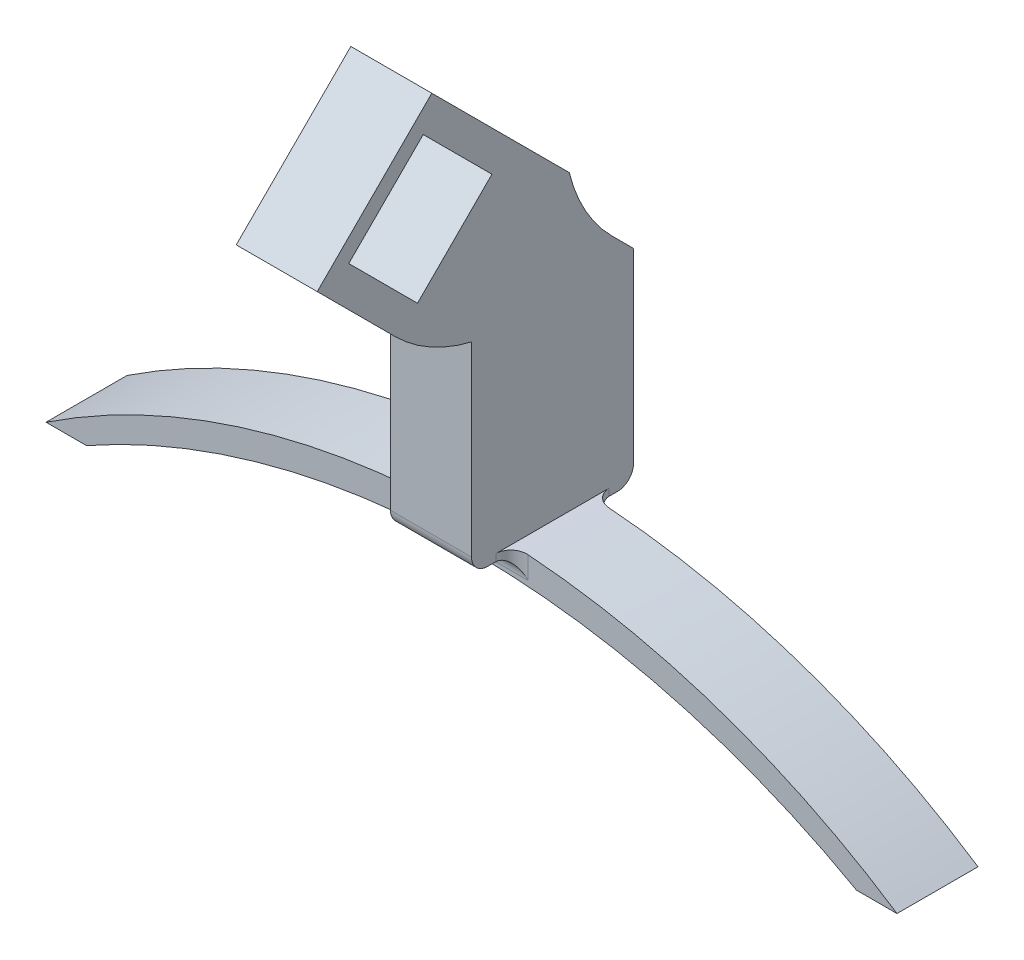
from build123d import *

# Parameters (mm, degrees)
BOSS_EXTRUDE1_DEPTH = 10
SCALE1_SCALE        = 0.5
SKETCH4_W           = 2.5
SKETCH4_H           = 5
BOSS_EXTRUDE4_DEPTH = 12
SKETCH5_W           = 5
SKETCH5_H           = 10
BOSS_EXTRUDE5_DEPTH = 0.5
BOSS_EXTRUDE6_REACH = 83.657
SKETCH7_W           = 5
SKETCH7_H           = 7.071067812
SKETCH8_W           = 5
SKETCH8_H           = 1.464466094
SKETCH8_H_2         = 7.071067812
BOSS_EXTRUDE7_DEPTH = 12
FILLET1_START       = 49
FILLET1_DEPTH       = 7
FILLET1_START_2     = 50.028561354
FILLET1_2_DEPTH     = 5
CUT_EXTRUDE1_DEPTH  = 53.473637274
FILLET2_R           = 1


with BuildPart() as part:
    # Sketch1 → Boss-Extrude1 (new body)
    with BuildSketch(Plane.XY):
        with BuildLine():
            Line((0, 0), (5, 0))
            ThreePointArc((5, 0), (52.528561354, 12.453541306), (100.057122708, 0))
            Line((100.057122708, 0), (105.057122708, 0))
            ThreePointArc((105.057122708, 0), (52.528561354, 15.847728612), (0, 0))
        make_face()
    extrude(amount=BOSS_EXTRUDE1_DEPTH)


with BuildPart() as part_1:
    # Scale1: scaled about (52.528561354, 9.724546383, 5)
    add(part.part.scale(SCALE1_SCALE).moved(Location((26.264280677, 4.862273191, 2.5))))



with BuildPart() as body_2:
    # Sketch4 → Boss-Extrude4 (new body)
    with BuildSketch(Plane(origin=(0, 12.786137497, 0), x_dir=(1, 0, 0), z_dir=(0, 1, 0))):
        with Locations((53.778561354, -5)):
            Rectangle(SKETCH4_W, SKETCH4_H)
        Polygon((50.028561354, 0), (50.028561354, -2.5), (52.528561354, -2.5), (55.028561354, -2.5), (55.028561354, 0), align=None)
        with Locations((51.278561354, -5)):
            Rectangle(SKETCH4_W, SKETCH4_H)
        Polygon((52.528561354, -7.5), (50.028561354, -7.5), (50.028561354, -10), (55.028561354, -10), (55.028561354, -7.5), align=None)
    extrude(amount=BOSS_EXTRUDE4_DEPTH)


with BuildPart() as part_2:
    add(part_1.part)

    add(body_2.part)  # Boss-Extrude5 merges body 2
    # Sketch5 → Boss-Extrude5 (add)
    with BuildSketch(Plane.XZ.offset(-12.786137497)):
        with Locations((52.528561354, 5)):
            Rectangle(SKETCH5_W, SKETCH5_H)
    extrude(amount=BOSS_EXTRUDE5_DEPTH)

    # Boss-Extrude6: up to this plane
    boss_extrude6_end = Plane(origin=(50.028561354, 12.286137497, 0), z_dir=(0, 0, 1))
    # Sketch7 → Boss-Extrude6 (add, up to the surface)
    with BuildSketch(Plane(origin=(0, 17.393068749, 17.393068749), x_dir=(1, 0, 0), z_dir=(0, 0.7071067811865464, 0.7071067811865488)), mode=Mode.PRIVATE) as boss_extrude6_sk1:
        with Locations((52.528561354, 13.990911998)):
            Rectangle(SKETCH7_W, SKETCH7_H)
    boss_extrude6_tool1 = split(extrude(boss_extrude6_sk1.sketch, amount=-BOSS_EXTRUDE6_REACH, mode=Mode.PRIVATE), bisect_by=boss_extrude6_end, keep=Keep.BOTH, mode=Mode.PRIVATE)
    add(boss_extrude6_tool1.solids().sort_by_distance((52.528561, 27.286137, 7.5))[0])

    # Sketch8 → Boss-Extrude7 (add)
    with BuildSketch(Plane(origin=(0, 17.393068749, 17.393068749), x_dir=(1, 0, 0), z_dir=(0, 0.7071067811865465, 0.7071067811865487))):
        with Locations((52.528561354, 18.258678951)):
            Rectangle(SKETCH8_W, SKETCH8_H)
        with Locations((52.528561354, 13.990911998)):
            Rectangle(SKETCH8_W, SKETCH8_H_2)
        with Locations((52.528561354, 9.723145045)):
            Rectangle(SKETCH8_W, SKETCH8_H)
    extrude(amount=BOSS_EXTRUDE7_DEPTH)

    # Fillet1: read off the stored shape, not the designer's step
    # Fillet1 outline → Fillet1 (cut)
    with BuildSketch(Plane.YZ.offset(FILLET1_START)):
        with BuildLine():
            Line((23.750603591, 11.035533906), (24.786137497, 10))
            ThreePointArc((24.786137497, 10), (25.785055254, 12.542376711), (27.434667987, 14.719598301))
            Line((27.434667987, 14.719598301), (23.750603591, 11.035533906))
        make_face()
    extrude(amount=FILLET1_DEPTH, mode=Mode.SUBTRACT)

    # Fillet1 2 outline → Fillet1 2 (add)
    with BuildSketch(Plane.YZ.offset(FILLET1_START_2)):
        with BuildLine():
            Line((29.786137497, 5), (26.102073102, 1.315935604))
            ThreePointArc((26.102073102, 1.315935604), (28.279294693, 2.965548337), (30.821671403, 3.964466094))
            Line((30.821671403, 3.964466094), (29.786137497, 5))
        make_face()
    extrude(amount=FILLET1_2_DEPTH)

    # Sketch9 → Cut-Extrude1 (cut, through all)
    with BuildSketch(Plane(origin=(55.028561354, 0, 0), x_dir=(0, 0, -1), z_dir=(1, 0, 0))):
        Polygon((-12.980077554, 37.362409129), (-17.576271632, 32.766215052), (-13.333630945, 28.523574364), (-8.737436867, 33.119768442), align=None)
    extrude(amount=-CUT_EXTRUDE1_DEPTH, mode=Mode.SUBTRACT)

    # Fillet2
    fillet2_edges = [part_2.edges().sort_by_distance(p)[0] for p in [
        (52.528561354, 12.286137497, 2.5),
        (55.028561354, 12.503212632, 2.5),
        (50.028561354, 12.503212632, 2.5),
        (50.028561354, 12.503212632, 7.5),
        (55.028561354, 12.503212632, 7.5),
        (52.528561354, 12.286137497, 10),
        (52.528561354, 12.286137497, 7.5),
        (52.528561354, 12.286137497, 0),
    ]]
    fillet(fillet2_edges, radius=FILLET2_R)


solid = part_2.part
